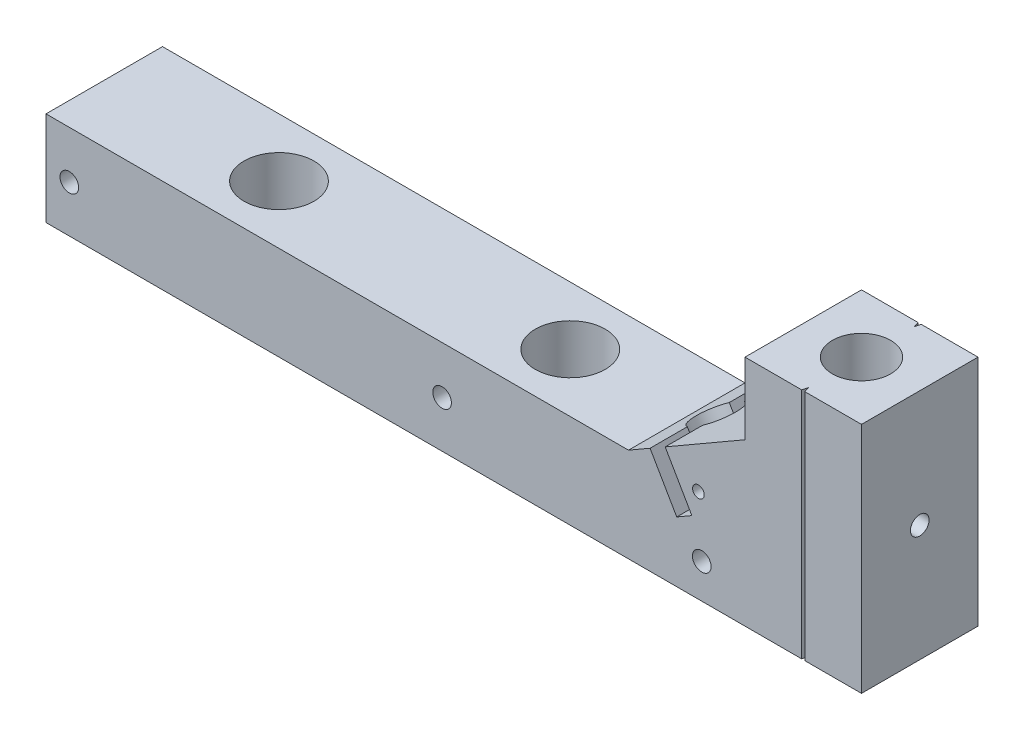
from build123d import *

# Parameters (mm, degrees)
SKETCH1_W                 = 20
SKETCH1_H                 = 10
BOSS_EXTRUDE1_DEPTH       = 20
SKETCH2_R                 = 2.5
CUT_EXTRUDE1_DEPTH        = 26.836409614
CUT_EXTRUDE2_DEPTH        = 27.191969955
SKETCH5_R                 = 1.95
CUT_EXTRUDE5_DEPTH        = 21.021203074
M2X0_4_TAPPED_HOLE1_D     = 1.6
M2X0_4_TAPPED_HOLE1_DEPTH = 6
M2X0_4_TAPPED_HOLE1_TIP   = 0.480688495
M2X0_4_TAPPED_HOLE2_D     = 1.6
M2X0_4_TAPPED_HOLE2_DEPTH = 6
M2X0_4_TAPPED_HOLE2_TIP   = 0.480688495
SKETCH14_W                = 10
SKETCH14_H                = 8.082903769
BOSS_EXTRUDE3_DEPTH       = 50
CUT_EXTRUDE7_REACH        = 67.371
SKETCH15_R                = 3
SKETCH18_R                = 0.5
CUT_EXTRUDE9_DEPTH        = 3
M2X0_4_TAPPED_HOLE3_D     = 1.6


with BuildPart() as part:
    # Sketch1 → Boss-Extrude1 (new body)
    with BuildSketch(Plane(origin=(0, 0, 0), x_dir=(1, 0, 0), z_dir=(0, 1, 0))):
        with Locations((-3.638888889, 4.027777778)):
            Rectangle(SKETCH1_W, SKETCH1_H)
    extrude(amount=BOSS_EXTRUDE1_DEPTH)

    # Sketch2 → Cut-Extrude1 (cut, through all)
    with BuildSketch(Plane(origin=(0, 20, 0), x_dir=(1, 0, 0), z_dir=(0, 1, 0))):
        with Locations((1.361111111, 4.027777778)):
            Circle(SKETCH2_R)
        Polygon((1.495085707, -0.972222222), (1.361111111, -0.472222222), (1.227136515, -0.972222222), align=None)
        Polygon((1.361111111, 8.527777778), (1.227136515, 9.027777778), (1.495085707, 9.027777778), align=None)
    extrude(amount=-CUT_EXTRUDE1_DEPTH, mode=Mode.SUBTRACT)

    # Sketch3 → Cut-Extrude2 (cut, through all)
    with BuildSketch(Plane.XY.offset(0.972222222)):
        Polygon((-13.638888889, 20), (-3.638888889, 20), (-3.638888889, 13.856406461), (-10.489369836, 9.901279442), (-8.200869836, 5.937481169), (-9.499907942, 5.187481169), (-11.788407942, 9.151279442), (-13.638888889, 8.082903769), align=None)
    extrude(amount=-CUT_EXTRUDE2_DEPTH, mode=Mode.SUBTRACT)

    # Sketch5 → Cut-Extrude5 (cut, through all)
    with BuildSketch(Plane(origin=(-6.909722222, 11.967989955, 0), x_dir=(0.8660254037844415, 0.49999999999999534, 0), z_dir=(-0.49999999999999534, 0.8660254037844415, 0))):
        with Locations((-4.883421027, 4.027777778)):
            Circle(SKETCH5_R)
    extrude(amount=-CUT_EXTRUDE5_DEPTH, mode=Mode.SUBTRACT)

    # M2x0.4 Tapped Hole1
    with Locations(Plane(origin=(6.361111111, 0, 0), x_dir=(0, 0, -1), z_dir=(1, 0, 0))):
        with Locations((4.027777778, 10)):
            Hole(M2X0_4_TAPPED_HOLE1_D / 2, depth=M2X0_4_TAPPED_HOLE1_DEPTH)
            with Locations((0, 0, -(M2X0_4_TAPPED_HOLE1_DEPTH + M2X0_4_TAPPED_HOLE1_TIP / 2))):  # 118° drill point
                Cone(0, M2X0_4_TAPPED_HOLE1_D / 2, M2X0_4_TAPPED_HOLE1_TIP, mode=Mode.SUBTRACT)

    # M2x0.4 Tapped Hole2
    with Locations(Plane.XY.offset(0.972222222)):
        with Locations((-7.350388889, 2.964404957)):
            Hole(M2X0_4_TAPPED_HOLE2_D / 2, depth=M2X0_4_TAPPED_HOLE2_DEPTH)
            with Locations((0, 0, -(M2X0_4_TAPPED_HOLE2_DEPTH + M2X0_4_TAPPED_HOLE2_TIP / 2))):  # 118° drill point
                Cone(0, M2X0_4_TAPPED_HOLE2_D / 2, M2X0_4_TAPPED_HOLE2_TIP, mode=Mode.SUBTRACT)

    # Sketch14 → Boss-Extrude3 (add)
    with BuildSketch(Plane.ZY.offset(13.638888889)):
        with Locations((-4.027777778, 4.041451884)):
            Rectangle(SKETCH14_W, SKETCH14_H)
    extrude(amount=BOSS_EXTRUDE3_DEPTH)

    # Sketch15 → Cut-Extrude7 (cut, up to next)
    with BuildSketch(Plane(origin=(0, 8.082903769, 0), x_dir=(1, 0, 0), z_dir=(0, 1, 0)), mode=Mode.PRIVATE) as cut_extrude7_sk1:
        with Locations((-48.638888889, 4.027777778)):
            Circle(SKETCH15_R)
    cut_extrude7_tool1 = extrude(cut_extrude7_sk1.sketch, amount=-CUT_EXTRUDE7_REACH, mode=Mode.PRIVATE) & part.part
    # Sketch15 → Cut-Extrude7 (cut, up to next)
    with BuildSketch(Plane(origin=(0, 8.082903769, 0), x_dir=(1, 0, 0), z_dir=(0, 1, 0)), mode=Mode.PRIVATE) as cut_extrude7_sk2:
        with Locations((-23.638888889, 4.027777778)):
            Circle(SKETCH15_R)
    cut_extrude7_tool2 = extrude(cut_extrude7_sk2.sketch, amount=-CUT_EXTRUDE7_REACH, mode=Mode.PRIVATE) & part.part
    add(cut_extrude7_tool1.solids().sort_by_distance((-48.638889, 8.082904, -4.027778))[0], mode=Mode.SUBTRACT)
    add(cut_extrude7_tool2.solids().sort_by_distance((-23.638889, 8.082904, -4.027778))[0], mode=Mode.SUBTRACT)

    # Sketch18 → Cut-Extrude9 (cut)
    with BuildSketch(Plane.XY.offset(0.972222222)):
        with Locations((-7.638888889, 8)):
            Circle(SKETCH18_R)
    extrude(amount=-CUT_EXTRUDE9_DEPTH, mode=Mode.SUBTRACT)

    # M2x0.4 Tapped Hole3 (through all)
    with Locations(Plane.XY.offset(0.972222222)):
        with Locations((-61.638888889, 4), (-29.638888889, 4)):
            Hole(M2X0_4_TAPPED_HOLE3_D / 2)


solid = part.part
